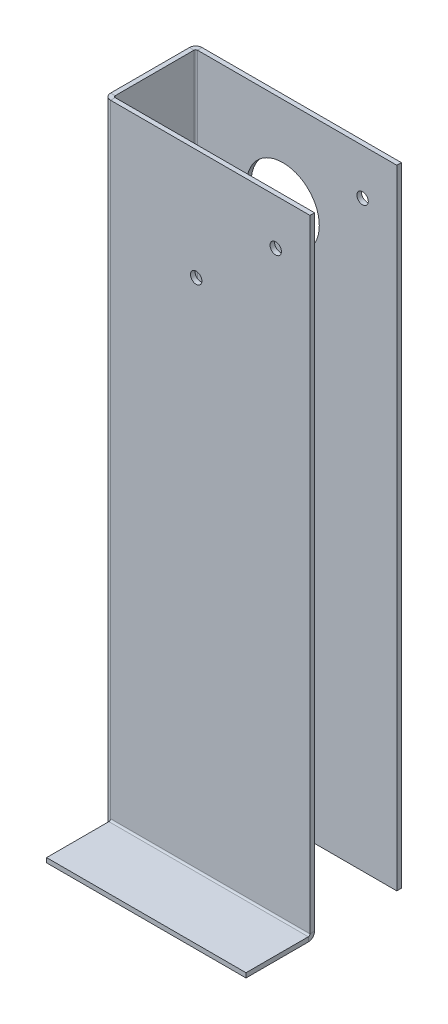
from build123d import *

# Parameters (mm, degrees)
SKETCH1_W                    = 90
SKETCH1_H                    = 275
BASE_FLANGE1_DEPTH           = 2
EDGE_FLANGE1_STRIP_W         = 9.4732
EDGE_FLANGE1_STRIP_H         = 2
EDGE_FLANGE1_STRIP_CUT_DEPTH = 275
EDGE_FLANGE1_DEPTH           = 275
EDGE_FLANGE2_STRIP_W         = 9.4732
EDGE_FLANGE2_STRIP_H         = 2
EDGE_FLANGE2_STRIP_CUT_DEPTH = 275
EDGE_FLANGE2_DEPTH           = 275
EDGE_FLANGE3_STRIP_W         = 9.4732
EDGE_FLANGE3_STRIP_H         = 2
EDGE_FLANGE3_STRIP_CUT_DEPTH = 87.2634
EDGE_FLANGE3_DEPTH           = 87.2634
CUT_EXTRUDE2_REACH           = 294.104
SKETCH18_R                   = 2.5
CUT_EXTRUDE1_REACH           = 299.236
SKETCH17_R                   = 15.875
SKETCH17_R_2                 = 2.5


# Sheet-metal steps are written as plain solids
with BuildPart() as part:
    # Sketch1 → Base-Flange1 (new body)
    with BuildSketch(Plane.XY):
        with Locations((45, 137.5)):
            Rectangle(SKETCH1_W, SKETCH1_H)
    extrude(amount=-BASE_FLANGE1_DEPTH)

    # Edge-Flange1 strip (across the edge) → Edge-Flange1 strip cut (cut)
    with BuildSketch(Plane(origin=(0, 0, -2), x_dir=(1, 0, 0), z_dir=(0, 1, 0))):
        with Locations((-2, -1)):
            Rectangle(EDGE_FLANGE1_STRIP_W, EDGE_FLANGE1_STRIP_H)
    extrude(amount=EDGE_FLANGE1_STRIP_CUT_DEPTH, mode=Mode.SUBTRACT)

    # Edge-Flange1 section (across the edge) → Edge-Flange1 (add)
    with BuildSketch(Plane(origin=(0, 0, -2), x_dir=(1, 0, 0), z_dir=(0, 1, 0))):
        with BuildLine():
            Line((0, 0.7366), (0, 38))
            Line((0, 38), (2, 38))
            Line((2, 38), (2, 0.7366))
            ThreePointArc((2, 0.7366), (2.215745145, 0.215745145), (2.7366, 0))
            Line((2.7366, 0), (2.7366, -2))
            ThreePointArc((2.7366, -2), (0.801531583, -1.198468417), (0, 0.7366))
        make_face()
    extrude(amount=EDGE_FLANGE1_DEPTH)

    # Edge-Flange2 strip (across the edge) → Edge-Flange2 strip cut (cut)
    with BuildSketch(Plane(origin=(2, 0, -40), x_dir=(0, 0, 1), z_dir=(0, 1, 0))):
        with Locations((-2, -1)):
            Rectangle(EDGE_FLANGE2_STRIP_W, EDGE_FLANGE2_STRIP_H)
    extrude(amount=EDGE_FLANGE2_STRIP_CUT_DEPTH, mode=Mode.SUBTRACT)

    # Edge-Flange2 section (across the edge) → Edge-Flange2 (add)
    with BuildSketch(Plane(origin=(2, 0, -40), x_dir=(0, 0, 1), z_dir=(0, 1, 0))):
        with BuildLine():
            Line((0, 0.7366), (0, 88))
            Line((0, 88), (2, 88))
            Line((2, 88), (2, 0.7366))
            ThreePointArc((2, 0.7366), (2.215745145, 0.215745145), (2.7366, 0))
            Line((2.7366, 0), (2.7366, -2))
            ThreePointArc((2.7366, -2), (0.801531583, -1.198468417), (0, 0.7366))
        make_face()
    extrude(amount=EDGE_FLANGE2_DEPTH)

    # Edge-Flange3 strip (across the edge) → Edge-Flange3 strip cut (cut)
    with BuildSketch(Plane.YZ.offset(2.7366)):
        with Locations((-2, -1)):
            Rectangle(EDGE_FLANGE3_STRIP_W, EDGE_FLANGE3_STRIP_H)
    extrude(amount=EDGE_FLANGE3_STRIP_CUT_DEPTH, mode=Mode.SUBTRACT)

    # Edge-Flange3 section (across the edge) → Edge-Flange3 (add)
    with BuildSketch(Plane.YZ.offset(2.7366)):
        with BuildLine():
            Line((0, 0.7366), (0, 28))
            Line((0, 28), (2, 28))
            Line((2, 28), (2, 0.7366))
            ThreePointArc((2, 0.7366), (2.215745145, 0.215745145), (2.7366, 0))
            Line((2.7366, 0), (2.7366, -2))
            ThreePointArc((2.7366, -2), (0.801531583, -1.198468417), (0, 0.7366))
        make_face()
    extrude(amount=EDGE_FLANGE3_DEPTH)

    # Sketch18 → Cut-Extrude2 (cut, up to next)
    with BuildSketch(Plane.XY, mode=Mode.PRIVATE) as cut_extrude2_sk1:
        with Locations((40.19, 226.48)):
            Circle(SKETCH18_R)
    cut_extrude2_tool1 = extrude(cut_extrude2_sk1.sketch, amount=-CUT_EXTRUDE2_REACH, mode=Mode.PRIVATE) & part.part
    # Sketch18 → Cut-Extrude2 (cut, up to next)
    with BuildSketch(Plane.XY, mode=Mode.PRIVATE) as cut_extrude2_sk2:
        with Locations((75, 255)):
            Circle(SKETCH18_R)
    cut_extrude2_tool2 = extrude(cut_extrude2_sk2.sketch, amount=-CUT_EXTRUDE2_REACH, mode=Mode.PRIVATE) & part.part
    add(cut_extrude2_tool1.solids().sort_by_distance((40.19, 226.48, 0))[0], mode=Mode.SUBTRACT)
    add(cut_extrude2_tool2.solids().sort_by_distance((75, 255, 0))[0], mode=Mode.SUBTRACT)

    # Sketch17 → Cut-Extrude1 (cut, up to next)
    with BuildSketch(Plane(origin=(0, 0, -40), x_dir=(-1, 0, 0), z_dir=(0, 0, -1)), mode=Mode.PRIVATE) as cut_extrude1_sk1:
        with Locations((-40.1866, 235.2)):
            Circle(SKETCH17_R)
    cut_extrude1_tool1 = extrude(cut_extrude1_sk1.sketch, amount=-CUT_EXTRUDE1_REACH, mode=Mode.PRIVATE) & part.part
    # Sketch17 → Cut-Extrude1 (cut, up to next)
    with BuildSketch(Plane(origin=(0, 0, -40), x_dir=(-1, 0, 0), z_dir=(0, 0, -1)), mode=Mode.PRIVATE) as cut_extrude1_sk2:
        with Locations(Location((-75, 255, 0), (0, 0, 180))):
            Circle(SKETCH17_R_2)
    cut_extrude1_tool2 = extrude(cut_extrude1_sk2.sketch, amount=-CUT_EXTRUDE1_REACH, mode=Mode.PRIVATE) & part.part
    add(cut_extrude1_tool1.solids().sort_by_distance((40.1866, 235.2, -40))[0], mode=Mode.SUBTRACT)
    add(cut_extrude1_tool2.solids().sort_by_distance((75, 255, -40))[0], mode=Mode.SUBTRACT)


solid = part.part
